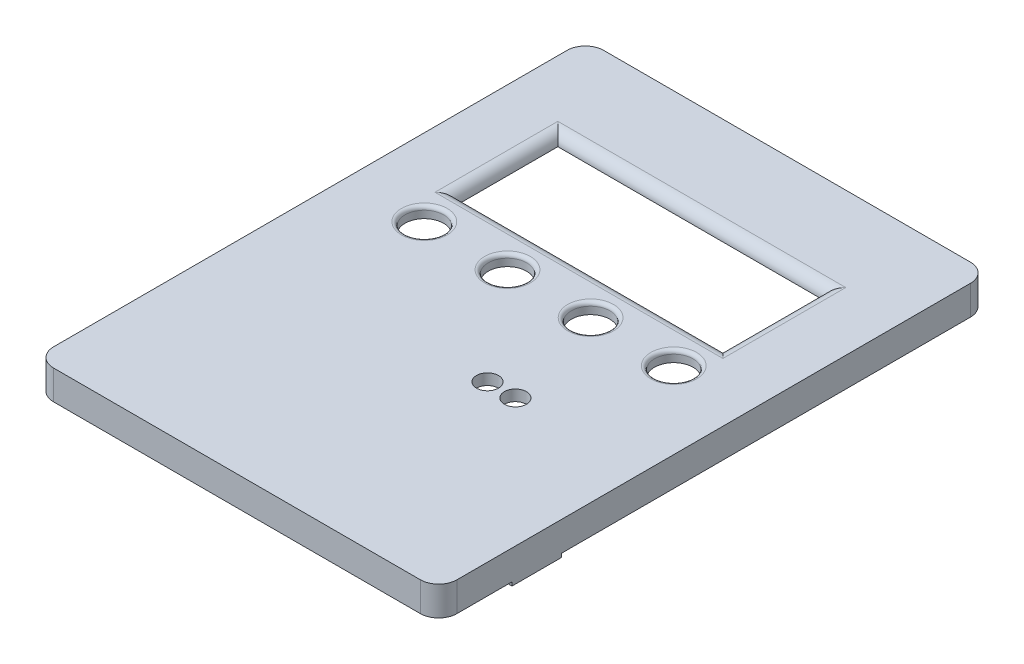
from build123d import *

# Parameters (mm, degrees)
ESBO_O1_W                = 110
ESBO_O1_H                = 150
RESSALTO_EXTRUS_O3_DEPTH = 8
FILETE2_R                = 5
CASCA1_T                 = -3
RESSALTO_EXTRUS_O7_START = 5
ESBO_O14_R               = 5
RESSALTO_EXTRUS_O7_DEPTH = 5
RESSALTO_EXTRUS_O4_START = -8
RESSALTO_EXTRUS_O4_DEPTH = 5
FILETE6_R                = 2
FILETE8_R                = 5
ESBO_O15_R               = 1.7
CORTE_EXTRUS_O3_DEPTH    = 3
ESBO_O18_R               = 5.25
CORTE_EXTRUS_O7_DEPTH    = 5
ESBO_O19_W               = 72.5
ESBO_O19_H               = 27.5
CORTE_EXTRUS_O8_DEPTH    = 5
FILETE9_R                = 3
FILETE10_R               = 1
ESBO_O20_R               = 3
CORTE_EXTRUS_O9_DEPTH    = 10
ESBO_O22_W               = 13.52
ESBO_O22_H               = 9.06512497
CORTE_EXTRUS_O11_DEPTH   = 20
ESBO_O8_W                = 3
ESBO_O8_H                = 13.5
RESSALTO_EXTRUS_O9_DEPTH = 1


with BuildPart() as part:
    # Esboço1 → Ressalto-extrusão3 (new body)
    with BuildSketch(Plane(origin=(0, 0, 0), x_dir=(1, 0, 0), z_dir=(0, 1, 0))):
        Rectangle(ESBO_O1_W, ESBO_O1_H)
    extrude(amount=-RESSALTO_EXTRUS_O3_DEPTH)

    # Filete2
    filete2_edges = [part.edges().sort_by_distance(p)[0] for p in [
        (55, -4, 75),
        (-55, -4, 75),
        (-55, -4, -75),
        (55, -4, -75),
    ]]
    fillet(filete2_edges, radius=FILETE2_R)

    # Casca1
    casca1_openings = [part.faces().sort_by_distance(p)[0] for p in [
        (0, -8, 0),
    ]]
    offset(amount=CASCA1_T, openings=casca1_openings, kind=Kind.INTERSECTION)

    # Esboço14 → Ressalto-extrusão7 (add)
    with BuildSketch(Plane(origin=(0, -3, 0), x_dir=(-1, 0, 0), z_dir=(0, -1, 0)).offset(RESSALTO_EXTRUS_O7_START)):
        with Locations((50, -70)):
            Circle(ESBO_O14_R)
        with Locations((-50, -70)):
            Circle(ESBO_O14_R)
        with Locations((-50, 70)):
            Circle(ESBO_O14_R)
        with Locations((50, 70)):
            Circle(ESBO_O14_R)
    extrude(amount=-RESSALTO_EXTRUS_O7_DEPTH)

    # Esboço6 → Ressalto-extrusão4 (add)
    with BuildSketch(Plane(origin=(0, 0, 0), x_dir=(1, 0, 0), z_dir=(0, 1, 0)).offset(RESSALTO_EXTRUS_O4_START)):
        Polygon((-32, -37), (32, -37), (32, -72), (35, -72), (35, -34), (-35, -34), (-35, -72), (-32, -72), align=None)
    extrude(amount=RESSALTO_EXTRUS_O4_DEPTH)

    # Filete6
    filete6_edges = [part.edges().sort_by_distance(p)[0] for p in [
        (-32, -5.5, 72),
        (-32, -5.5, 37),
        (32, -5.5, 37),
        (32, -5.5, 72),
    ]]
    fillet(filete6_edges, radius=FILETE6_R)

    # Filete8
    filete8_edges = [part.edges().sort_by_distance(p)[0] for p in [
        (35, -5.5, 34),
        (-35, -5.5, 34),
        (-35, -5.5, 72),
        (35, -5.5, 72),
    ]]
    fillet(filete8_edges, radius=FILETE8_R)

    # Esboço15 → Corte-extrusão3 (cut)
    with BuildSketch(Plane.XZ.offset(8)):
        with Locations(Location((-50, -70, 0), (0, 0, 270))):
            Circle(ESBO_O15_R)
        with Locations(Location((50, -70, 0), (0, 0, 270))):
            Circle(ESBO_O15_R)
        with Locations(Location((50, 70, 0), (0, 0, 270))):
            Circle(ESBO_O15_R)
        with Locations(Location((-50, 70, 0), (0, 0, 270))):
            Circle(ESBO_O15_R)
    extrude(amount=-CORTE_EXTRUS_O3_DEPTH, mode=Mode.SUBTRACT)

    # Esboço18 → Corte-extrusão7 (cut)
    with BuildSketch(Plane(origin=(0, 0, 0), x_dir=(1, 0, 0), z_dir=(0, 1, 0))):
        with Locations(Location((-34, 10.1, 0), (0, 0, 270))):
            Circle(ESBO_O18_R)
        with Locations(Location((-11.333333333, 10.1, 0), (0, 0, 270))):
            Circle(ESBO_O18_R)
        with Locations(Location((11.333333333, 10.1, 0), (0, 0, 270))):
            Circle(ESBO_O18_R)
        with Locations(Location((34, 10.1, 0), (0, 0, 270))):
            Circle(ESBO_O18_R)
    extrude(amount=-CORTE_EXTRUS_O7_DEPTH, mode=Mode.SUBTRACT)

    # Esboço19 → Corte-extrusão8 (cut)
    with BuildSketch(Plane(origin=(0, 0, 0), x_dir=(1, 0, 0), z_dir=(0, 1, 0))):
        with Locations((-0.25, 35.25)):
            Rectangle(ESBO_O19_W, ESBO_O19_H)
    extrude(amount=-CORTE_EXTRUS_O8_DEPTH, mode=Mode.SUBTRACT)

    # Filete9
    filete9_edges = [part.edges().sort_by_distance(p)[0] for p in [
        (36, 0, -35.25),
        (-0.25, 0, -49),
        (-36.5, 0, -35.25),
        (-0.25, 0, -21.5),
    ]]
    fillet(filete9_edges, radius=FILETE9_R - 0.0001)  # a hair under: the kernel refuses the full size

    # Filete10
    filete10_edges = [part.edges().sort_by_distance(p)[0] for p in [
        (-34, 0, -15.35),
        (-11.333333333, 0, -15.35),
        (11.333333333, 0, -15.35),
        (34, 0, -15.35),
    ]]
    fillet(filete10_edges, radius=FILETE10_R)

    # Esboço20 → Corte-extrusão9 (cut)
    with BuildSketch(Plane(origin=(0, 0, 0), x_dir=(1, 0, 0), z_dir=(0, 1, 0))):
        with Locations(Location((12.42, -19.11, 0), (0, 0, 270))):
            Circle(ESBO_O20_R)
        with Locations(Location((20.04, -19.11, 0), (0, 0, 270))):
            Circle(ESBO_O20_R)
    extrude(amount=-CORTE_EXTRUS_O9_DEPTH, mode=Mode.SUBTRACT)

    # Esboço22 → Corte-extrusão11 (cut)
    with BuildSketch(Plane.ZY.offset(55)):
        with Locations((14.11, -7.032562485)):
            Rectangle(ESBO_O22_W, ESBO_O22_H)
    extrude(amount=-CORTE_EXTRUS_O11_DEPTH, mode=Mode.SUBTRACT)

    # Esboço8 → Ressalto-extrusão9 (add)
    with BuildSketch(Plane(origin=(0, -8, 0), x_dir=(-1, 0, 0), z_dir=(0, -1, 0))):
        with Locations((-53.5, -48.25)):
            Rectangle(ESBO_O8_W, ESBO_O8_H)
    extrude(amount=RESSALTO_EXTRUS_O9_DEPTH)


solid = part.part
